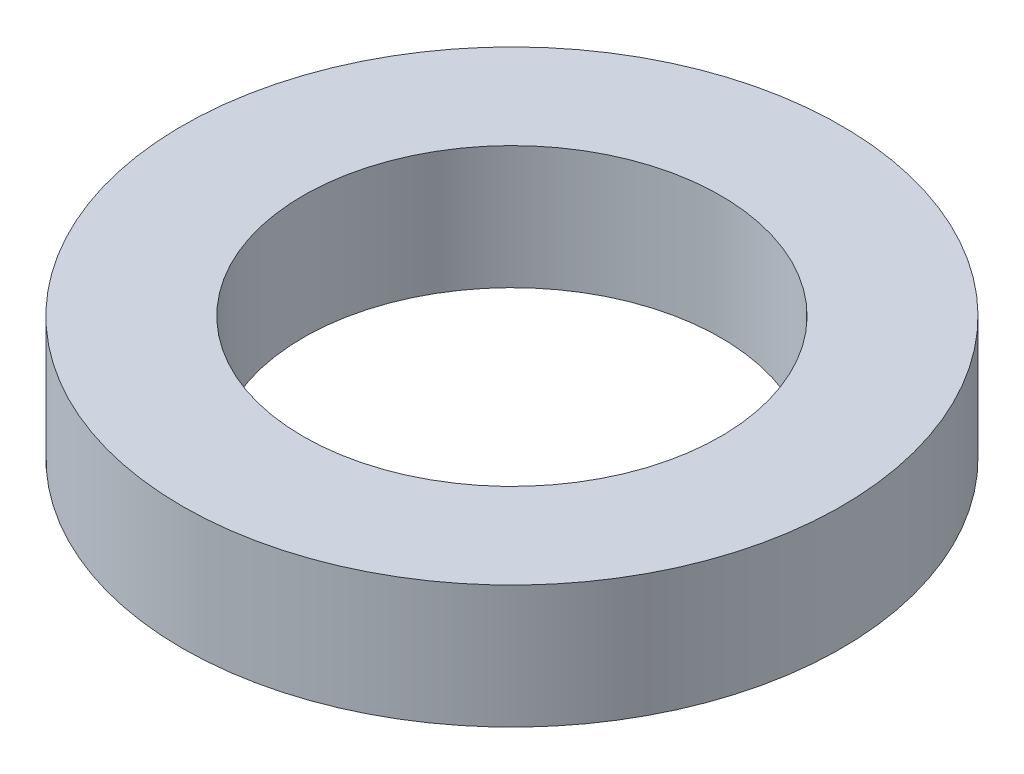
from build123d import *

# Parameters (mm, degrees)
SKETCH1_R           = 75
BOSS_EXTRUDE1_DEPTH = 28
SKETCH2_R           = 47.5
CUT_EXTRUDE1_DEPTH  = 110.69958979


with BuildPart() as part:
    # Sketch1 → Boss-Extrude1 (new body)
    with BuildSketch(Plane(origin=(0, 0, 0), x_dir=(1, 0, 0), z_dir=(0, 1, 0))):
        Circle(SKETCH1_R)
    extrude(amount=BOSS_EXTRUDE1_DEPTH)

    # Sketch2 → Cut-Extrude1 (cut, through all)
    with BuildSketch(Plane(origin=(0, 0, 0), x_dir=(1, 0, 0), z_dir=(0, 1, 0))):
        Circle(SKETCH2_R)
    extrude(amount=CUT_EXTRUDE1_DEPTH, mode=Mode.SUBTRACT)


solid = part.part
